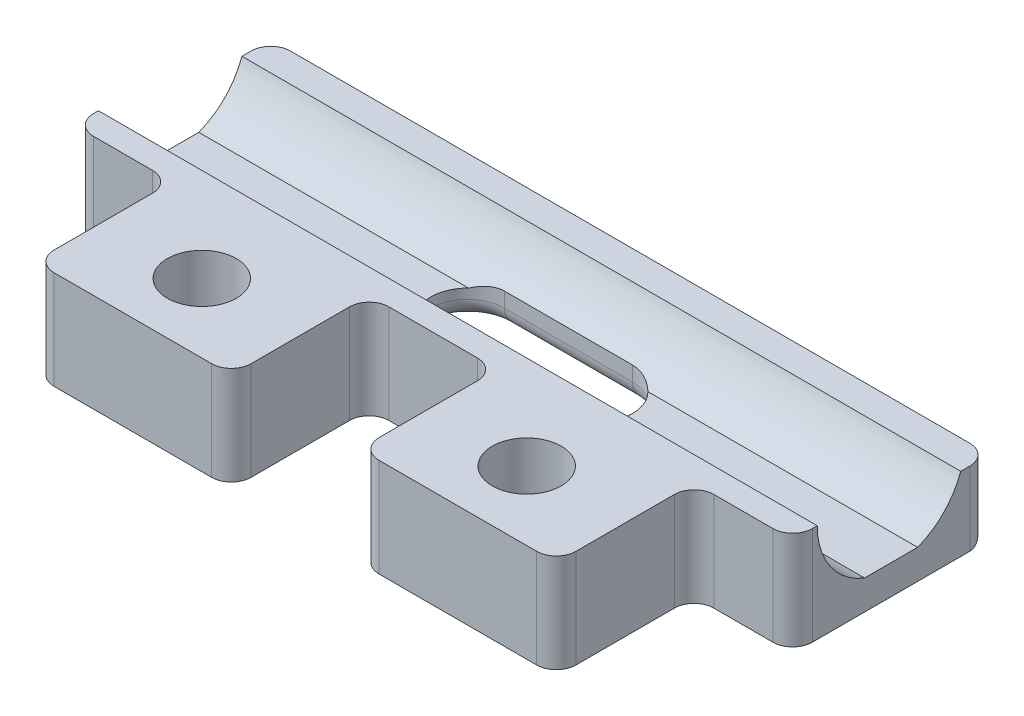
from build123d import *

# Parameters (mm, degrees)
BOSS_EXTRUDE1_DEPTH       = 10
SKETCH2_R                 = 3.5
CUT_EXTRUDE1_DEPTH        = 10
CUT_EXTRUDE2_DEPTH        = 78.491935064
FILLET1_R                 = 2
MOVE_START                = 7.5
MOVE_FACE1_DEPTH          = 2.5
USB_C_CHARGE_ACCESS_DEPTH = 5
FILLET3_R                 = 2


# Read off the part's stored shape, not the designer's step: Move Face1
with BuildPart() as part:
    # Sketch1 → Boss-Extrude1 (new body)
    with BuildSketch(Plane(origin=(0, 0, 0), x_dir=(1, 0, 0), z_dir=(0, 1, 0))):
        Polygon((20, -10), (10, -10), (10, -24), (-10, -24), (-10, -10), (-23, -10), (-23, -24), (-43, -24), (-43, -10), (-53, -10), (-53, 10), (20, 10), align=None)
    extrude(amount=BOSS_EXTRUDE1_DEPTH)

    # Sketch2 → Cut-Extrude1 (cut)
    with BuildSketch(Plane(origin=(0, 10, 0), x_dir=(1, 0, 0), z_dir=(0, 1, 0))):
        with Locations(Location((0, -17, 0), (0, 0, 270))):
            Circle(SKETCH2_R)
        with Locations(Location((-33, -17, 0), (0, 0, 270))):
            Circle(SKETCH2_R)
    extrude(amount=-CUT_EXTRUDE1_DEPTH, mode=Mode.SUBTRACT)

    # Sketch3 → Cut-Extrude2 (cut, through all)
    with BuildSketch(Plane(origin=(20, 0, 0), x_dir=(0, 0, -1), z_dir=(1, 0, 0))):
        with BuildLine():
            Line((-2.692582404, 3), (2.692582404, 3))
            ThreePointArc((2.692582404, 3), (0, 17.5), (-2.692582404, 3))
        make_face()
    extrude(amount=-CUT_EXTRUDE2_DEPTH, mode=Mode.SUBTRACT)

    # Fillet1
    fillet1_edges = [part.edges().sort_by_distance(p)[0] for p in [
        (-16.5, 0, -10),
        (20, 5, 10),
        (10, 5, 10),
        (10, 5, 24),
        (-10, 5, 24),
        (-10, 5, 10),
        (-23, 5, 10),
        (-23, 5, 24),
        (-43, 5, 24),
        (-43, 5, 10),
        (-53, 5, 10),
        (-53, 5, -10),
        (20, 5, -10),
    ]]
    fillet(fillet1_edges, radius=FILLET1_R)

    # Move Face1 outline → Move Face1 (cut)
    with BuildSketch(Plane(origin=(0, 0, 0), x_dir=(1, 0, 0), z_dir=(0, 1, 0)).offset(MOVE_START)):
        with BuildLine():
            Line((18, 10), (-51, 10))
            ThreePointArc((-51, 10), (-52.414213562, 9.414213562), (-53, 8))
            Line((-53, 8), (-53.000000001, 6))
            Line((-53.000000001, 6), (20.000000001, 6))
            Line((20.000000001, 6), (20, 8))
            ThreePointArc((20, 8), (19.414213562, 9.414213562), (18, 10))
        make_face()
    extrude(amount=MOVE_FACE1_DEPTH, mode=Mode.SUBTRACT)

    # Sketch4 → USB-C charge access (cut, symmetric)
    with BuildSketch(Plane(origin=(0, 3, 0), x_dir=(1, 0, 0), z_dir=(0, 1, 0))):
        with BuildLine():
            Line((-10, -3.75), (-23, -3.75))
            ThreePointArc((-23, -3.75), (-26.75, 0), (-23, 3.75))
            Line((-23, 3.75), (-10, 3.75))
            ThreePointArc((-10, 3.75), (-6.25, 0), (-10, -3.75))
        make_face()
    extrude(amount=USB_C_CHARGE_ACCESS_DEPTH, both=True, mode=Mode.SUBTRACT)

    # Fillet3
    fillet3_edges = [part.edges().sort_by_distance(p)[0] for p in [
        (-16.5, 0, 3.75),
        (-16.5, 0, -3.75),
        (-6.25, 0, 0),
        (-26.75, 0, 0),
    ]]
    fillet(fillet3_edges, radius=FILLET3_R)


solid = part.part
